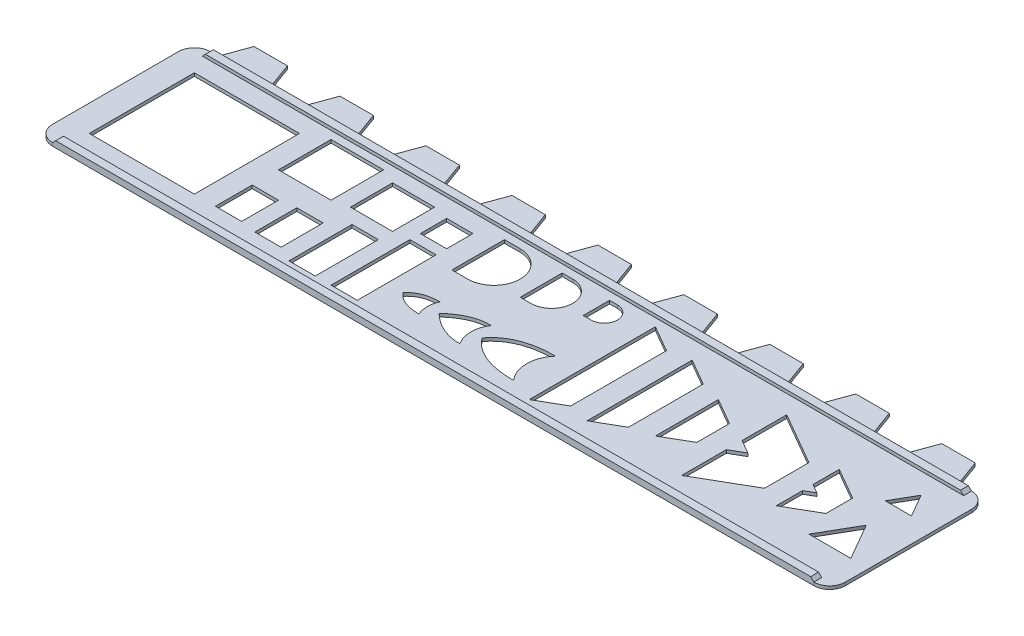
from build123d import *

# Parameters (mm, degrees)
SKETCH1_W             = 160
SKETCH1_H             = 30
BOSS_EXTRUDE1_DEPTH   = 0.6
SKETCH2_W             = 20
SKETCH2_H             = 20
SKETCH2_W_2           = 10
SKETCH2_H_2           = 10
SKETCH2_W_3           = 8
SKETCH2_H_3           = 8
SKETCH2_W_4           = 5
SKETCH2_H_4           = 5
SKETCH2_H_5           = 7
SKETCH2_H_6           = 12
SKETCH2_H_7           = 15
CUT_EXTRUDE1_DEPTH    = 0.6
CUT_EXTRUDE3_DEPTH    = 0.6
CUT_EXTRUDE4_DEPTH    = 0.6
CUT_EXTRUDE5_DEPTH    = 0.6
SKETCH7_W             = 9.123147958
SKETCH7_H             = 30
CUT_EXTRUDE6_DEPTH    = 0.6
BOSS_EXTRUDE2_DEPTH   = 0.6
BOSS_EXTRUDE2_2_DEPTH = 0.6
BOSS_EXTRUDE2_3_DEPTH = 0.6
BOSS_EXTRUDE2_4_DEPTH = 0.6
BOSS_EXTRUDE2_5_DEPTH = 0.6
BOSS_EXTRUDE2_6_DEPTH = 0.6
BOSS_EXTRUDE2_7_DEPTH = 0.6
BOSS_EXTRUDE2_8_DEPTH = 0.6
BOSS_EXTRUDE2_9_DEPTH = 0.6
FILLET1_R             = 3
SKETCH9_W             = 144.876852042
SKETCH9_H             = 1.5
BOSS_EXTRUDE3_DEPTH   = 0.6
CHAMFER1_SIZE         = 0.6


with BuildPart() as part:
    # Sketch1 → Boss-Extrude1 (new body)
    with BuildSketch(Plane(origin=(0, 0, 0), x_dir=(1, 0, 0), z_dir=(0, 1, 0))):
        Rectangle(SKETCH1_W, SKETCH1_H)
    extrude(amount=BOSS_EXTRUDE1_DEPTH)

    # Sketch2 → Cut-Extrude1 (cut)
    with BuildSketch(Plane(origin=(0, 0.6, 0), x_dir=(1, 0, 0), z_dir=(0, 1, 0))):
        with Locations((-65, 0)):
            Rectangle(SKETCH2_W, SKETCH2_H)
        with BuildLine():
            Line((-5, 12), (-7, 12))
            Line((-7, 12), (-7, 4))
            Line((-7, 4), (-5, 4))
            ThreePointArc((-5, 4), (-1, 8), (-5, 12))
        make_face()
        with Locations((-46, 7)):
            Rectangle(SKETCH2_W_2, SKETCH2_H_2)
        with Locations((-34, 6.702147352)):
            Rectangle(SKETCH2_W_3, SKETCH2_H_3)
        with Locations((-24.5, 7.5)):
            Rectangle(SKETCH2_W_4, SKETCH2_H_4)
        with Locations((-48.5, -6.5)):
            Rectangle(SKETCH2_W_4, SKETCH2_H_5)
        with BuildLine():
            Line((-15, 12), (-18, 12))
            Line((-18, 12), (-18, 2))
            Line((-18, 2), (-15, 2))
            ThreePointArc((-15, 2), (-10, 7), (-15, 12))
        make_face()
        with Locations((-40.5, -6.5)):
            Rectangle(SKETCH2_W_4, SKETCH2_H_3)
        with Locations((-32.5, -6)):
            Rectangle(SKETCH2_W_4, SKETCH2_H_6)
        with Locations((-24.5, -4.5)):
            Rectangle(SKETCH2_W_4, SKETCH2_H_7)
        with BuildLine():
            Line((3.5, 12), (2, 12))
            Line((2, 12), (2, 7))
            Line((2, 7), (3.5, 7))
            ThreePointArc((3.5, 7), (6, 9.5), (3.5, 12))
        make_face()
        with BuildLine():
            ThreePointArc((6.07040459, -2.329353078), (4.557646776, -6.329353078), (6.07040459, -10.329353078))
            add(Edge.make_bspline(
                [(6.07040459, -10.329353078), (-0.928342944, -10.345027892), (-3.92959541, -6.329353078)],
                knots=[0, 0, 0, 1, 1, 1], degree=2))
            add(Edge.make_bspline(
                [(6.07040459, -2.329353078), (-0.928342944, -2.313678264), (-3.92959541, -6.329353078)],
                knots=[0, 0, 0, 1, 1, 1], degree=2))
        make_face()
        with BuildLine():
            ThreePointArc((-5.087434715, -3.386719861), (-5.990420234, -6.386719861), (-5.087434715, -9.386719861))
            add(Edge.make_bspline(
                [(-5.087434715, -9.386719861), (-8.816275614, -9.455842755), (-12.087434715, -6.386719861)],
                knots=[0, 0, 0, 1, 1, 1], degree=2))
            add(Edge.make_bspline(
                [(-5.087434715, -3.386719861), (-8.816275614, -3.317596967), (-12.087434715, -6.386719861)],
                knots=[0, 0, 0, 1, 1, 1], degree=2))
        make_face()
        with BuildLine():
            ThreePointArc((-13.885876864, -4.386719861), (-14.307566838, -6.386719861), (-13.885876864, -8.386719861))
            add(Edge.make_bspline(
                [(-13.885876864, -8.386719861), (-17.299200456, -8.394557268), (-18.885876864, -6.386719861)],
                knots=[0, 0, 0, 1, 1, 1], degree=2))
            add(Edge.make_bspline(
                [(-13.885876864, -4.386719861), (-17.299200456, -4.378882454), (-18.885876864, -6.386719861)],
                knots=[0, 0, 0, 1, 1, 1], degree=2))
        make_face()
    extrude(amount=-CUT_EXTRUDE1_DEPTH, mode=Mode.SUBTRACT)

    # Sketch3 → Cut-Extrude3 (cut)
    with BuildSketch(Plane(origin=(0, 0.6, 0), x_dir=(1, 0, 0), z_dir=(0, 1, 0))):
        Polygon((10.717645067, 12), (10.717645067, -12), (15.717645067, -9.113248654), (15.717645067, 9.113248654), align=None)
        Polygon((19.717645067, 10), (19.717645067, -10), (24.717645067, -7.113248654), (24.717645067, 7.113248654), align=None)
        Polygon((28.717645067, 6), (28.717645067, -6), (33.717645067, -3.113248654), (33.717645067, 3.113248654), align=None)
    extrude(amount=-CUT_EXTRUDE3_DEPTH, mode=Mode.SUBTRACT)

    # Sketch5 → Cut-Extrude4 (cut)
    with BuildSketch(Plane(origin=(0, 0.6, 0), x_dir=(1, 0, 0), z_dir=(0, 1, 0))):
        Polygon((37.717645067, 10), (37.717645067, 1.5), (40.315721279, 0), (37.717645067, -1.5), (37.717645067, -10), (47.717645067, -4.226497308), (47.717645067, 4.226497308), align=None)
        Polygon((51.717645067, 6), (51.717645067, 1), (53.449695875, 0), (51.717645067, -1), (51.717645067, -6), (57.717645067, -2.535898385), (57.717645067, 2.535898385), align=None)
    extrude(amount=-CUT_EXTRUDE4_DEPTH, mode=Mode.SUBTRACT)

    # Sketch6 → Cut-Extrude5 (cut)
    with BuildSketch(Plane(origin=(0, 0.6, 0), x_dir=(1, 0, 0), z_dir=(0, 1, 0))):
        Polygon((63.758994289, 9.519130037), (61.258994289, 5.189003018), (66.258994289, 5.189003018), align=None)
        Polygon((63.484953651, -0.639697818), (59.484953651, -7.567901048), (67.484953651, -7.567901048), align=None)
    extrude(amount=-CUT_EXTRUDE5_DEPTH, mode=Mode.SUBTRACT)

    # Sketch7 → Cut-Extrude6 (cut)
    with BuildSketch(Plane(origin=(0, 0.6, 0), x_dir=(1, 0, 0), z_dir=(0, 1, 0))):
        with Locations((75.438426021, 0)):
            Rectangle(SKETCH7_W, SKETCH7_H)
    extrude(amount=-CUT_EXTRUDE6_DEPTH, mode=Mode.SUBTRACT)

    # Fillet1
    fillet1_edges = [part.edges().sort_by_distance(p)[0] for p in [
        (70.876852042, 0.3, 15),
        (70.876852042, 0.3, -15),
        (-80, 0.3, 15),
        (-80, 0.3, -15),
    ]]
    fillet(fillet1_edges, radius=FILLET1_R)



with BuildPart() as body_2:
    # Sketch8 → Boss-Extrude2 (new body)
    with BuildSketch(Plane(origin=(0, 0.6, 0), x_dir=(1, 0, 0), z_dir=(0, 1, 0))):
        Polygon((-75.472294668, 15), (-73.652443497, 20), (-67.292145839, 20), (-65.472294668, 15), align=None)
    extrude(amount=-BOSS_EXTRUDE2_DEPTH)


with BuildPart() as body_3:
    # Sketch8 → Boss-Extrude2 2 (new body)
    with BuildSketch(Plane(origin=(0, 0.6, 0), x_dir=(1, 0, 0), z_dir=(0, 1, 0))):
        Polygon((-59.112294668, 15), (-57.292443497, 20), (-50.932145839, 20), (-49.112294668, 15), align=None)
    extrude(amount=-BOSS_EXTRUDE2_2_DEPTH)


with BuildPart() as body_4:
    # Sketch8 → Boss-Extrude2 3 (new body)
    with BuildSketch(Plane(origin=(0, 0.6, 0), x_dir=(1, 0, 0), z_dir=(0, 1, 0))):
        Polygon((-42.752294668, 15), (-40.932443497, 20), (-34.572145839, 20), (-32.752294668, 15), align=None)
    extrude(amount=-BOSS_EXTRUDE2_3_DEPTH)


with BuildPart() as body_5:
    # Sketch8 → Boss-Extrude2 4 (new body)
    with BuildSketch(Plane(origin=(0, 0.6, 0), x_dir=(1, 0, 0), z_dir=(0, 1, 0))):
        Polygon((-26.392294668, 15), (-24.572443497, 20), (-18.212145839, 20), (-16.392294668, 15), align=None)
    extrude(amount=-BOSS_EXTRUDE2_4_DEPTH)


with BuildPart() as body_6:
    # Sketch8 → Boss-Extrude2 5 (new body)
    with BuildSketch(Plane(origin=(0, 0.6, 0), x_dir=(1, 0, 0), z_dir=(0, 1, 0))):
        Polygon((-10.032294668, 15), (-8.212443497, 20), (-1.852145839, 20), (-0.032294668, 15), align=None)
    extrude(amount=-BOSS_EXTRUDE2_5_DEPTH)


with BuildPart() as body_7:
    # Sketch8 → Boss-Extrude2 6 (new body)
    with BuildSketch(Plane(origin=(0, 0.6, 0), x_dir=(1, 0, 0), z_dir=(0, 1, 0))):
        Polygon((6.327705332, 15), (8.147556503, 20), (14.507854161, 20), (16.327705332, 15), align=None)
    extrude(amount=-BOSS_EXTRUDE2_6_DEPTH)


with BuildPart() as body_8:
    # Sketch8 → Boss-Extrude2 7 (new body)
    with BuildSketch(Plane(origin=(0, 0.6, 0), x_dir=(1, 0, 0), z_dir=(0, 1, 0))):
        Polygon((22.687705332, 15), (24.507556503, 20), (30.867854161, 20), (32.687705332, 15), align=None)
    extrude(amount=-BOSS_EXTRUDE2_7_DEPTH)


with BuildPart() as body_9:
    # Sketch8 → Boss-Extrude2 8 (new body)
    with BuildSketch(Plane(origin=(0, 0.6, 0), x_dir=(1, 0, 0), z_dir=(0, 1, 0))):
        Polygon((39.047705332, 15), (40.867556503, 20), (47.227854161, 20), (49.047705332, 15), align=None)
    extrude(amount=-BOSS_EXTRUDE2_8_DEPTH)


with BuildPart() as body_10:
    # Sketch8 → Boss-Extrude2 9 (new body)
    with BuildSketch(Plane(origin=(0, 0.6, 0), x_dir=(1, 0, 0), z_dir=(0, 1, 0))):
        Polygon((55.407705332, 15), (57.227556503, 20), (63.587854161, 20), (65.407705332, 15), align=None)
    extrude(amount=-BOSS_EXTRUDE2_9_DEPTH)


with BuildPart() as part_1:
    add(part.part)

    add(body_2.part)  # Boss-Extrude3 merges body 2

    add(body_3.part)  # Boss-Extrude3 merges body 3

    add(body_4.part)  # Boss-Extrude3 merges body 4

    add(body_5.part)  # Boss-Extrude3 merges body 5

    add(body_6.part)  # Boss-Extrude3 merges body 6

    add(body_7.part)  # Boss-Extrude3 merges body 7

    add(body_8.part)  # Boss-Extrude3 merges body 8

    add(body_9.part)  # Boss-Extrude3 merges body 9

    add(body_10.part)  # Boss-Extrude3 merges body 10
    # Sketch9 → Boss-Extrude3 (add)
    with BuildSketch(Plane(origin=(0, 0.6, 0), x_dir=(1, 0, 0), z_dir=(0, 1, 0))):
        with Locations((-4.561573979, 14.25)):
            Rectangle(SKETCH9_W, SKETCH9_H)
        with Locations((-4.561573979, -14.25)):
            Rectangle(SKETCH9_W, SKETCH9_H)
    extrude(amount=BOSS_EXTRUDE3_DEPTH)

    # Chamfer1
    chamfer1_edges = [part_1.edges().sort_by_distance(p)[0] for p in [
        (67.876852042, 1.2, 14.25),
        (67.876852042, 1.2, -14.25),
        (-77, 1.2, 14.25),
        (-77, 1.2, -14.25),
    ]]
    chamfer(chamfer1_edges, length=CHAMFER1_SIZE - 0.0001)  # a hair under: the kernel refuses the full size


solid = part_1.part
